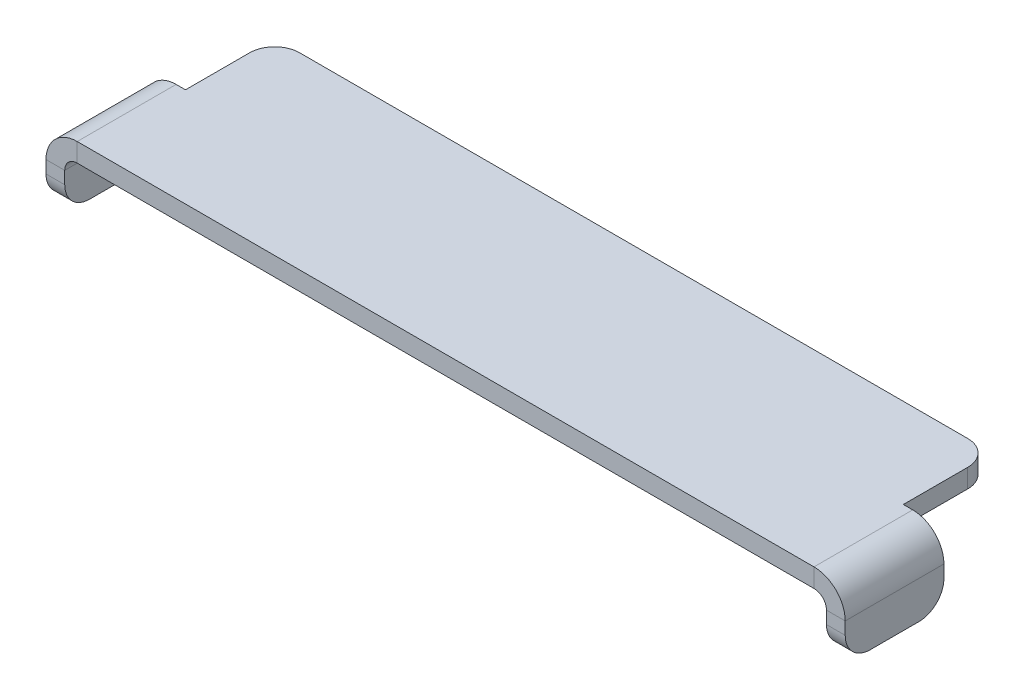
from build123d import *

# Parameters (mm, degrees)
SKETCH1_W                       = 64
SKETCH1_H                       = 15.060468003
BASE_FLANGE1_DEPTH              = 1.5
EDGE_FLANGE1_STRIP_W            = 8
EDGE_FLANGE1_STRIP_H            = 1.5
EDGE_FLANGE1_STRIP_CUT_DEPTH    = 7.904411042
EDGE_FLANGE1_RELIEF_W           = 8.75
EDGE_FLANGE1_RELIEF_H           = 0.75
EDGE_FLANGE1_RELIEF_CUT_DEPTH   = 1.5
EDGE_FLANGE1_STRIP_2_W          = 8
EDGE_FLANGE1_STRIP_2_H          = 1.5
EDGE_FLANGE1_STRIP_CUT_2_DEPTH  = 7.92099203
EDGE_FLANGE1_RELIEF_2_W         = 8.75
EDGE_FLANGE1_RELIEF_2_H         = 0.75
EDGE_FLANGE1_RELIEF_CUT_2_DEPTH = 1.5
EDGE_FLANGE1_DEPTH              = 7.904411042
EDGE_FLANGE1_BEND_DEPTH         = 7.92099203
SKETCH31_W                      = 3.25
SKETCH31_H                      = 6.406056961
SKETCH31_H_2                    = 6.389475973
CUT_EXTRUDE1_DEPTH              = 10
FILLET1_R                       = 2


# Sheet-metal steps are written as plain solids
with BuildPart() as part:
    # Sketch1 → Base-Flange1 (new body)
    with BuildSketch(Plane(origin=(0, 0, 0), x_dir=(1, 0, 0), z_dir=(0, 1, 0))):
        with Locations((32, 7.530234002)):
            Rectangle(SKETCH1_W, SKETCH1_H)
    extrude(amount=-BASE_FLANGE1_DEPTH)

    # Edge-Flange1 strip (across the edge) → Edge-Flange1 strip cut (cut)
    with BuildSketch(Plane(origin=(64, -1.5, -7.904411042), x_dir=(-1, 0, 0), z_dir=(0, 0, 1))):
        with Locations((-1.5, -0.75)):
            Rectangle(EDGE_FLANGE1_STRIP_W, EDGE_FLANGE1_STRIP_H)
    extrude(amount=EDGE_FLANGE1_STRIP_CUT_DEPTH, mode=Mode.SUBTRACT)

    # Edge-Flange1 relief (on the sheet) → Edge-Flange1 relief cut (cut)
    with BuildSketch(Plane(origin=(61.5, -1.5, -7.904411042), x_dir=(-1, 0, 0), z_dir=(0, -1, 0))):
        with Locations((-3.625, 0.375)):
            Rectangle(EDGE_FLANGE1_RELIEF_W, EDGE_FLANGE1_RELIEF_H)
    extrude(amount=-EDGE_FLANGE1_RELIEF_CUT_DEPTH, mode=Mode.SUBTRACT)

    # Edge-Flange1 strip 2 (across the edge) → Edge-Flange1 strip cut 2 (cut)
    with BuildSketch(Plane(origin=(0, -1.5, 0), x_dir=(1, 0, 0), z_dir=(0, 0, -1))):
        with Locations((-1.5, -0.75)):
            Rectangle(EDGE_FLANGE1_STRIP_2_W, EDGE_FLANGE1_STRIP_2_H)
    extrude(amount=EDGE_FLANGE1_STRIP_CUT_2_DEPTH, mode=Mode.SUBTRACT)

    # Edge-Flange1 relief 2 (on the sheet) → Edge-Flange1 relief cut 2 (cut)
    with BuildSketch(Plane(origin=(2.5, -1.5, 0), x_dir=(1, 0, 0), z_dir=(0, -1, 0))):
        with Locations((-3.625, -8.29599203)):
            Rectangle(EDGE_FLANGE1_RELIEF_2_W, EDGE_FLANGE1_RELIEF_2_H)
    extrude(amount=-EDGE_FLANGE1_RELIEF_CUT_2_DEPTH, mode=Mode.SUBTRACT)

    # Edge-Flange1 section (across the edge) → Edge-Flange1 (add)
    with BuildSketch(Plane(origin=(64, -1.5, -7.904411042), x_dir=(-1, 0, 0), z_dir=(0, 0, 1))):
        with BuildLine():
            Line((0, 1), (0, 4))
            Line((0, 4), (1.5, 4))
            Line((1.5, 4), (1.5, 1))
            ThreePointArc((1.5, 1), (1.792893219, 0.292893219), (2.5, 0))
            Line((2.5, 0), (2.5, -1.5))
            ThreePointArc((2.5, -1.5), (0.732233047, -0.767766953), (0, 1))
        make_face()
    extrude(amount=EDGE_FLANGE1_DEPTH)

    # Edge-Flange1 section 2 (across the edge) → Edge-Flange1 bend (add)
    with BuildSketch(Plane(origin=(0, -1.5, 0), x_dir=(1, 0, 0), z_dir=(0, 0, -1))):
        with BuildLine():
            Line((0, 1), (0, 4))
            Line((0, 4), (1.5, 4))
            Line((1.5, 4), (1.5, 1))
            ThreePointArc((1.5, 1), (1.792893219, 0.292893219), (2.5, 0))
            Line((2.5, 0), (2.5, -1.5))
            ThreePointArc((2.5, -1.5), (0.732233047, -0.767766953), (0, 1))
        make_face()
    extrude(amount=EDGE_FLANGE1_BEND_DEPTH)

    # Sketch31 → Cut-Extrude1 (cut)
    with BuildSketch(Plane(origin=(0, 0, 0), x_dir=(1, 0, 0), z_dir=(0, 1, 0))):
        with Locations((62.375, 11.857439523)):
            Rectangle(SKETCH31_W, SKETCH31_H)
        with Locations((1.625, 11.865730017)):
            Rectangle(SKETCH31_W, SKETCH31_H_2)
    extrude(amount=-CUT_EXTRUDE1_DEPTH, mode=Mode.SUBTRACT)

    # Fillet1
    fillet1_edges = [part.edges().sort_by_distance(p)[0] for p in [
        (60.75, -0.75, -15.060468003),
        (3.25, -0.75, -15.060468003),
        (63.25, -5.5, -7.904411042),
        (63.25, -5.5, 0),
        (0.75, -5.5, 0),
        (0.75, -5.5, -7.92099203),
    ]]
    fillet(fillet1_edges, radius=FILLET1_R)


solid = part.part
